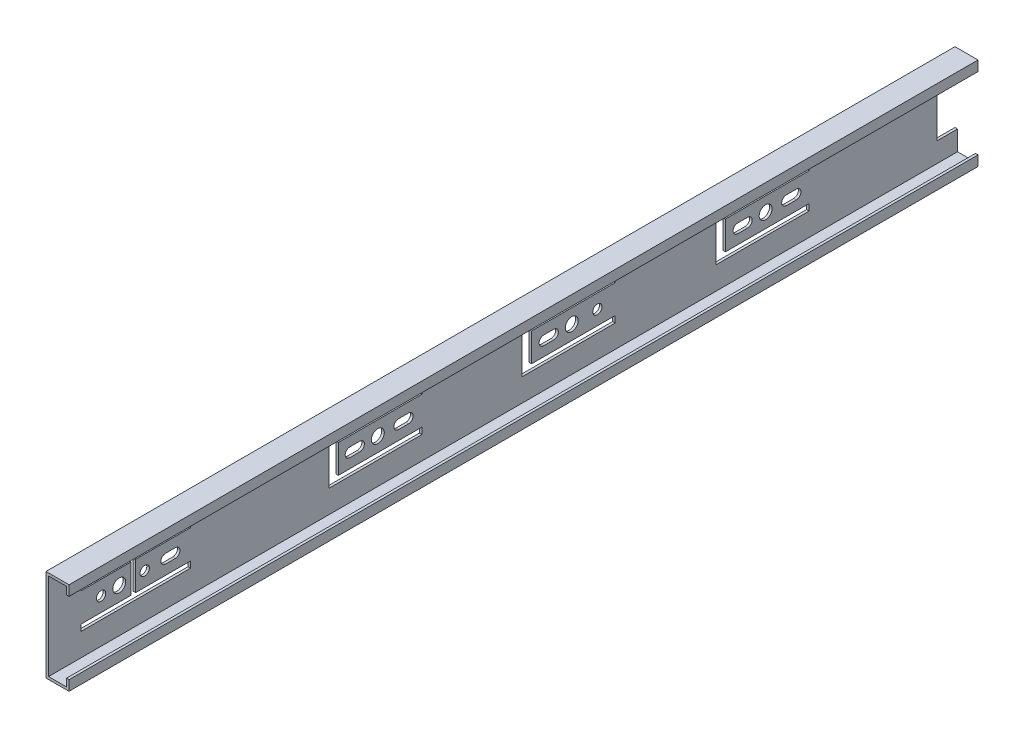
from build123d import *

# Parameters (mm, degrees)
SKETCH1_W                      = 450
SKETCH1_H                      = 45.7
BOSS_EXTRUDE1_DEPTH            = 11.4
CUT_EXTRUDE1_DEPTH             = 451.615814747
SKETCH3_W                      = 10.25
SKETCH3_H                      = 23.6
CUT_EXTRUDE2_DEPTH             = 451.723953768
CUT_EXTRUDE3_DEPTH             = 451.693620323
CUT_EXTRUDE4_DEPTH             = 451.693620323
CUT_EXTRUDE5_DEPTH             = 451.693620323
CUT_EXTRUDE6_DEPTH             = 451.693620323
CUT_EXTRUDE7_DEPTH             = 451.693620323
CUT_EXTRUDE8_DEPTH             = 451.693620323
CUT_EXTRUDE9_DEPTH             = 451.693620323
CUT_EXTRUDE10_DEPTH            = 451.693620323
CUT_EXTRUDE11_DEPTH            = 451.693620323
CUT_EXTRUDE12_DEPTH            = 451.723953768
F_6_4_6_4_DIAMETER_HOLE1_D     = 6.4
F_6_4_6_4_DIAMETER_HOLE1_DEPTH = 11.4
F_4_6_4_6_DIAMETER_HOLE1_D     = 4.6
F_4_6_4_6_DIAMETER_HOLE1_DEPTH = 11.4


with BuildPart() as part:
    # Sketch1 → Boss-Extrude1 (new body)
    with BuildSketch(Plane(origin=(5.7, 0, 0), x_dir=(0, 0, -1), z_dir=(1, 0, 0))):
        with Locations((-225, 0)):
            Rectangle(SKETCH1_W, SKETCH1_H)
    extrude(amount=-BOSS_EXTRUDE1_DEPTH)

    # Sketch2 → Cut-Extrude1 (cut, through all)
    with BuildSketch(Plane.XY.offset(450)):
        Polygon((5.7, 17.85), (4.43, 17.85), (4.43, 21.58), (-4.43, 21.58), (-4.43, -21.58), (4.43, -21.58), (4.43, -17.85), (5.7, -17.85), align=None)
    extrude(amount=-CUT_EXTRUDE1_DEPTH, mode=Mode.SUBTRACT)

    # Sketch3 → Cut-Extrude2 (cut, through all)
    with BuildSketch(Plane.ZY.offset(5.7)):
        with Locations((5.125, 0)):
            Rectangle(SKETCH3_W, SKETCH3_H)
    extrude(amount=-CUT_EXTRUDE2_DEPTH, mode=Mode.SUBTRACT)

    # Sketch4 → Cut-Extrude3 (cut, through all)
    with BuildSketch(Plane(origin=(-4.43, 0, 0), x_dir=(0, 0, -1), z_dir=(1, 0, 0))):
        Polygon((-169.5, -10.25), (-169.5, -7.05), (-210.9, -7.05), (-210.9, 7.05), (-169.5, 7.05), (-169.5, 10.25), (-215.5, 10.25), (-215.5, -10.25), align=None)
    extrude(amount=-CUT_EXTRUDE3_DEPTH, mode=Mode.SUBTRACT)

    # Sketch5 → Cut-Extrude4 (cut, through all)
    with BuildSketch(Plane(origin=(-4.43, 0, 0), x_dir=(0, 0, -1), z_dir=(1, 0, 0))):
        Polygon((-119.5, -10.25), (-73.5, -10.25), (-73.5, -7.05), (-114.9, -7.05), (-114.9, 7.05), (-73.5, 7.05), (-73.5, 10.25), (-119.5, 10.25), align=None)
    extrude(amount=-CUT_EXTRUDE4_DEPTH, mode=Mode.SUBTRACT)

    # Sketch6 → Cut-Extrude5 (cut, through all)
    with BuildSketch(Plane(origin=(-4.43, 0, 0), x_dir=(0, 0, -1), z_dir=(1, 0, 0))):
        Polygon((-265.15, 7.05), (-265.15, 10.25), (-311.15, 10.25), (-311.15, -10.25), (-265.15, -10.25), (-265.15, -7.05), (-306.55, -7.05), (-306.55, 7.05), align=None)
    extrude(amount=-CUT_EXTRUDE5_DEPTH, mode=Mode.SUBTRACT)

    # Sketch7 → Cut-Extrude6 (cut, through all)
    with BuildSketch(Plane(origin=(-4.43, 0, 0), x_dir=(0, 0, -1), z_dir=(1, 0, 0))):
        with BuildLine():
            Line((-79.85, 2.3), (-84.75, 2.3))
            ThreePointArc((-84.75, 2.3), (-87.05, 0), (-84.75, -2.3))
            Line((-84.75, -2.3), (-79.85, -2.3))
            ThreePointArc((-79.85, -2.3), (-77.55, 0), (-79.85, 2.3))
        make_face()
    extrude(amount=-CUT_EXTRUDE6_DEPTH, mode=Mode.SUBTRACT)

    # Sketch8 → Cut-Extrude7 (cut, through all)
    with BuildSketch(Plane(origin=(-4.43, 0, 0), x_dir=(0, 0, -1), z_dir=(1, 0, 0))):
        with BuildLine():
            Line((-108.85, -2.3), (-103.95, -2.3))
            ThreePointArc((-103.95, -2.3), (-101.65, 0), (-103.95, 2.3))
            Line((-103.95, 2.3), (-108.85, 2.3))
            ThreePointArc((-108.85, 2.3), (-111.15, 0), (-108.85, -2.3))
        make_face()
    extrude(amount=-CUT_EXTRUDE7_DEPTH, mode=Mode.SUBTRACT)

    # Sketch9 → Cut-Extrude8 (cut, through all)
    with BuildSketch(Plane(origin=(-4.43, 0, 0), x_dir=(0, 0, -1), z_dir=(1, 0, 0))):
        with BuildLine():
            Line((-387.25, 2.3), (-392.15, 2.3))
            ThreePointArc((-392.15, 2.3), (-394.45, 0), (-392.15, -2.3))
            Line((-392.15, -2.3), (-387.25, -2.3))
            ThreePointArc((-387.25, -2.3), (-384.95, 0), (-387.25, 2.3))
        make_face()
    extrude(amount=-CUT_EXTRUDE8_DEPTH, mode=Mode.SUBTRACT)

    # Sketch10 → Cut-Extrude9 (cut, through all)
    with BuildSketch(Plane(origin=(-4.43, 0, 0), x_dir=(0, 0, -1), z_dir=(1, 0, 0))):
        with BuildLine():
            Line((-199.95, 2.3), (-204.85, 2.3))
            ThreePointArc((-204.85, 2.3), (-207.15, 0), (-204.85, -2.3))
            Line((-204.85, -2.3), (-199.95, -2.3))
            ThreePointArc((-199.95, -2.3), (-197.65, 0), (-199.95, 2.3))
        make_face()
    extrude(amount=-CUT_EXTRUDE9_DEPTH, mode=Mode.SUBTRACT)

    # Sketch11 → Cut-Extrude10 (cut, through all)
    with BuildSketch(Plane(origin=(-4.43, 0, 0), x_dir=(0, 0, -1), z_dir=(1, 0, 0))):
        with BuildLine():
            Line((-295.95, 2.3), (-300.85, 2.3))
            ThreePointArc((-300.85, 2.3), (-303.15, 0), (-300.85, -2.3))
            Line((-300.85, -2.3), (-295.95, -2.3))
            ThreePointArc((-295.95, -2.3), (-293.65, 0), (-295.95, 2.3))
        make_face()
    extrude(amount=-CUT_EXTRUDE10_DEPTH, mode=Mode.SUBTRACT)

    # Sketch12 → Cut-Extrude11 (cut, through all)
    with BuildSketch(Plane(origin=(-4.43, 0, 0), x_dir=(0, 0, -1), z_dir=(1, 0, 0))):
        with BuildLine():
            Line((-271.85, 2.3), (-276.75, 2.3))
            ThreePointArc((-276.75, 2.3), (-279.05, 0), (-276.75, -2.3))
            Line((-276.75, -2.3), (-271.85, -2.3))
            ThreePointArc((-271.85, -2.3), (-269.55, 0), (-271.85, 2.3))
        make_face()
    extrude(amount=-CUT_EXTRUDE11_DEPTH, mode=Mode.SUBTRACT)

    # Sketch13 → Cut-Extrude12 (cut, through all)
    with BuildSketch(Plane.ZY.offset(5.7)):
        Polygon((434, -7.15), (409.2, -7.15), (409.2, 7.15), (434, 7.15), (434, 10.25), (379.65, 10.25), (379.65, 7.15), (406.9, 7.15), (406.9, -7.15), (379.65, -7.15), (379.65, -10.25), (434, -10.25), align=None)
    extrude(amount=-CUT_EXTRUDE12_DEPTH, mode=Mode.SUBTRACT)

    # Ø6.4 (6.4) Diameter Hole1
    with Locations(Plane.ZY.offset(5.7)):
        with Locations((415, 0), (287, 0), (191, 0), (95, 0)):
            Hole(F_6_4_6_4_DIAMETER_HOLE1_D / 2, depth=F_6_4_6_4_DIAMETER_HOLE1_DEPTH)

    # Ø4.6 (4.6) Diameter Hole1
    with Locations(Plane.ZY.offset(5.7)):
        with Locations((424, 0), (402.4, 0), (178.3, 0)):
            Hole(F_4_6_4_6_DIAMETER_HOLE1_D / 2, depth=F_4_6_4_6_DIAMETER_HOLE1_DEPTH)


solid = part.part
